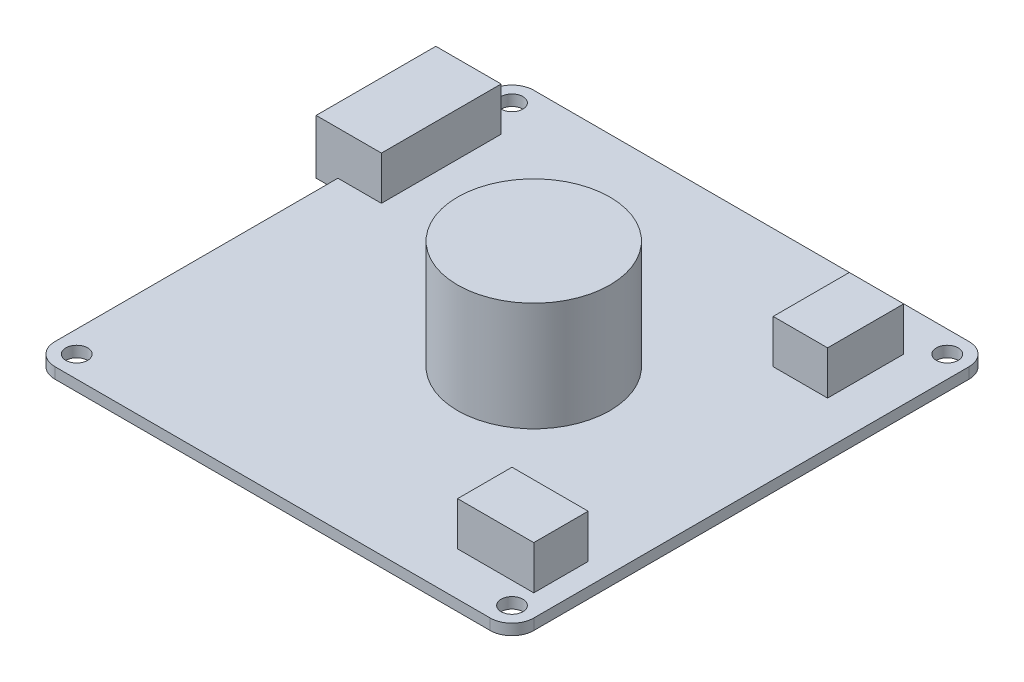
from build123d import *

# Parameters (mm, degrees)
SKETCH1_R           = 1
SKETCH1_W           = 7
SKETCH1_H           = 5
SKETCH1_R_2         = 7
SKETCH1_W_2         = 5
SKETCH1_H_2         = 7
BOSS_EXTRUDE1_DEPTH = 1
SKETCH1_3_R         = 7
BOSS_EXTRUDE2_DEPTH = 11
SKETCH1_4_W         = 6
SKETCH1_4_H         = 11
SKETCH1_4_W_2       = 5
SKETCH1_4_H_2       = 7
SKETCH1_4_W_3       = 7
SKETCH1_4_H_3       = 5
BOSS_EXTRUDE3_DEPTH = 5


with BuildPart() as part:
    # Sketch1 → Boss-Extrude1 (new body)
    with BuildSketch(Plane(origin=(0, 0, 0), x_dir=(1, 0, 0), z_dir=(0, 1, 0))):
        with BuildLine():
            ThreePointArc((-22, -20), (-21.414213562, -21.414213562), (-20, -22))
            Line((-20, -22), (20, -22))
            ThreePointArc((20, -22), (21.414213562, -21.414213562), (22, -20))
            Line((22, -20), (22, 20))
            ThreePointArc((22, 20), (21.414213562, 21.414213562), (20, 22))
            Line((20, 22), (-20, 22))
            ThreePointArc((-20, 22), (-21.414213562, 21.414213562), (-22, 20))
            Line((-22, 20), (-22, 17))
            Line((-22, 17), (-18, 17))
            Line((-18, 17), (-18, 6))
            Line((-18, 6), (-22, 6))
            Line((-22, 6), (-22, -20))
        make_face()
        with Locations((-20, -20)):
            Circle(SKETCH1_R, mode=Mode.SUBTRACT)
        with Locations((20, -20)):
            Circle(SKETCH1_R, mode=Mode.SUBTRACT)
        with Locations((16.5, -15.5)):
            Rectangle(SKETCH1_W, SKETCH1_H, mode=Mode.SUBTRACT)
        with Locations((-20, 20)):
            Circle(SKETCH1_R, mode=Mode.SUBTRACT)
        with Locations((2, 0)):
            Circle(SKETCH1_R_2, mode=Mode.SUBTRACT)
        with Locations((15.5, 14.5)):
            Rectangle(SKETCH1_W_2, SKETCH1_H_2, mode=Mode.SUBTRACT)
        with Locations((20, 20)):
            Circle(SKETCH1_R, mode=Mode.SUBTRACT)
    extrude(amount=BOSS_EXTRUDE1_DEPTH)

    # Sketch1<3> → Boss-Extrude2 (add)
    with BuildSketch(Plane(origin=(0, 0, 0), x_dir=(1, 0, 0), z_dir=(0, 1, 0))):
        with Locations((2, 0)):
            Circle(SKETCH1_3_R)
    extrude(amount=BOSS_EXTRUDE2_DEPTH)

    # Sketch1<4> → Boss-Extrude3 (add)
    with BuildSketch(Plane(origin=(0, 0, 0), x_dir=(1, 0, 0), z_dir=(0, 1, 0))):
        with Locations((-21, 11.5)):
            Rectangle(SKETCH1_4_W, SKETCH1_4_H)
        with Locations((15.5, 14.5)):
            Rectangle(SKETCH1_4_W_2, SKETCH1_4_H_2)
        with Locations((16.5, -15.5)):
            Rectangle(SKETCH1_4_W_3, SKETCH1_4_H_3)
    extrude(amount=BOSS_EXTRUDE3_DEPTH)


solid = part.part
